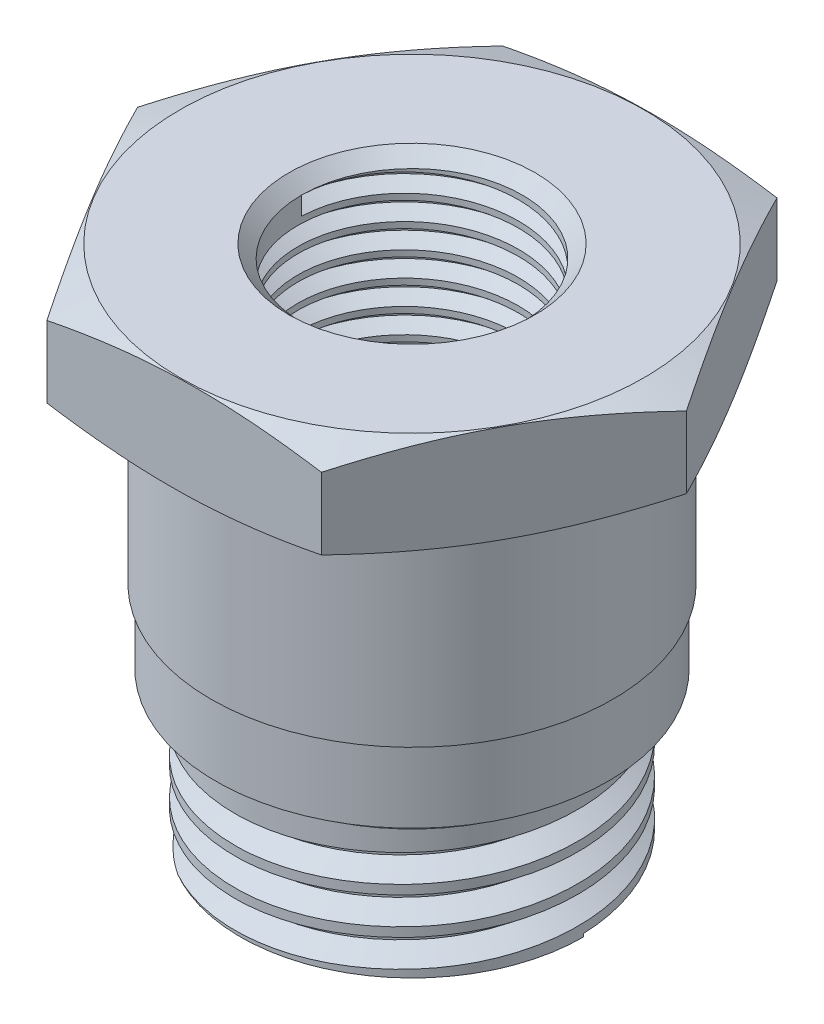
from build123d import *

# Parameters (mm, degrees)
RESSALTO_EXTRUS_O1_DEPTH             = 4
ESBO_O4_OUTSIDE_W                    = 101.256
ESBO_O4_OUTSIDE_H                    = 98.55
ESBO_O4_OUTSIDE_R                    = 9.5
CORTE_EXTRUS_O2_DEPTH                = 13
CORTE_EXTRUS_O2_DRAFT                = -70
ESBO_O5_OUTSIDE_W                    = 101.256
ESBO_O5_OUTSIDE_H                    = 98.55
ESBO_O5_OUTSIDE_R                    = 9.472261518
CORTE_EXTRUS_O3_DEPTH                = 13
CORTE_EXTRUS_O3_DRAFT                = -70
ESBO_O6_R                            = 8.2
RESSALTO_EXTRUS_O2_DEPTH             = 8
ESBO_O7_R                            = 8
RESSALTO_EXTRUS_O3_DEPTH             = 3
ESBO_O8_R                            = 7
RESSALTO_EXTRUS_O4_DEPTH             = 6
ESBO_O9_R                            = 5.2
CORTE_EXTRUS_O4_DEPTH                = 14
FURO_ROSCADO_DE_M10X1_01_D           = 9
FURO_ROSCADO_DE_M10X1_01_CSINK_D     = 10.05
FURO_ROSCADO_DE_M10X1_01_CSINK_ANGLE = 90
ROSCA1_PITCH                         = 1
MOVER_START                          = -19
MOVER_FACE1_OUTLINE_R                = 7
MOVER_FACE1_OUTLINE_R_2              = 5.2
MOVER_FACE1_DEPTH                    = 2
ESBO_O15_R                           = 9.5
CORTE_EXTRUS_O6_DEPTH                = 2
ESBO_O19_W                           = 1.509856989
ESBO_O19_H                           = 0.736006145
ROSCA2_PITCH                         = 1.5


# Read off the part's stored shape, not the designer's step: Mover face1
with BuildPart() as part:
    # Esboço1 → Ressalto-extrusão1 (new body)
    with BuildSketch(Plane(origin=(0, 0, 0), x_dir=(1, 0, 0), z_dir=(0, 1, 0))):
        Polygon((5.283091157, 9.613650772), (-5.684120213, 9.382116538), (-10.96721137, -0.231534234), (-5.283091157, -9.613650772), (5.684120213, -9.382116538), (10.96721137, 0.231534234), align=None)
    extrude(amount=RESSALTO_EXTRUS_O1_DEPTH)


with BuildPart() as corte_extrus_o2_tool:
    # Esboço4 outside → Corte-extrusão2 (with draft: the straight prism first)
    with BuildSketch(Plane.XZ):
        Rectangle(ESBO_O4_OUTSIDE_W, ESBO_O4_OUTSIDE_H)
        Circle(ESBO_O4_OUTSIDE_R, mode=Mode.SUBTRACT)
    extrude(amount=-CORTE_EXTRUS_O2_DEPTH)
    # Corte-extrusão2: the draft: its side faces are tilted about the plane it starts from
    corte_extrus_o2_sides = [corte_extrus_o2_tool.faces().sort_by_distance(p)[0] for p in [
        (0, 6.5, -49.275),
        (50.628, 6.5, 0),
        (0, 6.5, 49.275),
        (-50.628, 6.5, 0),
        (-9.5, 6.5, 0),
    ]]
    draft(corte_extrus_o2_sides, Plane.XZ, CORTE_EXTRUS_O2_DRAFT)


with BuildPart() as part_1:
    add(part.part)

    # Corte-extrusão2: cut by corte_extrus_o2_tool
    add(corte_extrus_o2_tool.part, mode=Mode.SUBTRACT)


with BuildPart() as corte_extrus_o3_tool:
    # Esboço5 outside → Corte-extrusão3 (with draft: the straight prism first)
    with BuildSketch(Plane(origin=(0, 4, 0), x_dir=(1, 0, 0), z_dir=(0, 1, 0))):
        Rectangle(ESBO_O5_OUTSIDE_W, ESBO_O5_OUTSIDE_H)
        Circle(ESBO_O5_OUTSIDE_R, mode=Mode.SUBTRACT)
    extrude(amount=-CORTE_EXTRUS_O3_DEPTH)
    # Corte-extrusão3: the draft: its side faces are tilted about the plane it starts from
    corte_extrus_o3_sides = [corte_extrus_o3_tool.faces().sort_by_distance(p)[0] for p in [
        (0, -2.5, 49.275),
        (50.628, -2.5, 0),
        (0, -2.5, -49.275),
        (-50.628, -2.5, 0),
        (-9.472261518, -2.5, 0),
    ]]
    draft(corte_extrus_o3_sides, Plane(origin=(0, 4, 0), x_dir=(1, 0, 0), z_dir=(0, 1, 0)), CORTE_EXTRUS_O3_DRAFT)


with BuildPart() as part_2:
    add(part_1.part)

    # Corte-extrusão3: cut by corte_extrus_o3_tool
    add(corte_extrus_o3_tool.part, mode=Mode.SUBTRACT)

    # Esboço6 → Ressalto-extrusão2 (add)
    with BuildSketch(Plane.XZ):
        with Locations(Location((0, 0, 0), (0, 0, 90))):
            Circle(ESBO_O6_R)
    extrude(amount=RESSALTO_EXTRUS_O2_DEPTH)

    # Esboço7 → Ressalto-extrusão3 (add)
    with BuildSketch(Plane.XZ.offset(8)):
        with Locations(Location((0, 0, 0), (0, 0, 270))):
            Circle(ESBO_O7_R)
    extrude(amount=RESSALTO_EXTRUS_O3_DEPTH)

    # Esboço8 → Ressalto-extrusão4 (add)
    with BuildSketch(Plane.XZ.offset(11)):
        with Locations(Location((0, 0, 0), (0, 0, 270))):
            Circle(ESBO_O8_R)
    extrude(amount=RESSALTO_EXTRUS_O4_DEPTH)

    # Esboço9 → Corte-extrusão4 (cut)
    with BuildSketch(Plane.XZ.offset(17)):
        with Locations(Location((0, 0, 0), (0, 0, 270))):
            Circle(ESBO_O9_R)
    extrude(amount=-CORTE_EXTRUS_O4_DEPTH, mode=Mode.SUBTRACT)

    # Furo roscado de M10x1.01 (through all)
    with Locations(Plane(origin=(0, 4, 0), x_dir=(1, 0, 0), z_dir=(0, 1, 0))):
        with Locations((0, 0)):
            CounterSinkHole(FURO_ROSCADO_DE_M10X1_01_D / 2, FURO_ROSCADO_DE_M10X1_01_CSINK_D / 2, counter_sink_angle=FURO_ROSCADO_DE_M10X1_01_CSINK_ANGLE)

    # Rosca1: the profile of Perfil da rosca1 profile screwed along a right-hand helix of 10 turns, 8 arcs to a turn; built about Z, then put on its axis
    rosca1_z = Axis((0, 0, 0), (0, 0, 1))
    rosca1_corners = [(4.4997, 0, -0.000173205), (5.041265875, 0, 0.312499999), (5.041265875, 0, 0.437499999), (4.4997, 0, 0.750173202)]
    with BuildLine(mode=Mode.PRIVATE) as rosca1_profile:
        Line(rosca1_corners[0], rosca1_corners[1])
        Line(rosca1_corners[1], rosca1_corners[2])
        Line(rosca1_corners[2], rosca1_corners[3])
        Line(rosca1_corners[3], rosca1_corners[0])
    rosca1_cap = Face(rosca1_profile.wire())
    rosca1_turn_angles = [0, 22.5, 45, 67.5, 90, 112.5, 135, 157.5, 180, 202.5, 225, 247.5, 270, 292.5, 315, 337.5, 360]
    rosca1_turn_weights = [1, 0.9238795325112867, 1, 0.9238795325112867, 1, 0.9238795325112867, 1, 0.9238795325112867, 1, 0.9238795325112867, 1, 0.9238795325112867, 1, 0.9238795325112867, 1, 0.9238795325112867, 1]
    rosca1_turn_rails = [Edge.make_bspline([Vector(p[0], p[1], 0).rotate(rosca1_z, rosca1_turn_angles[k]) / rosca1_turn_weights[k] + Vector(0, 0, p[2] + ROSCA1_PITCH * rosca1_turn_angles[k] / 360) for k in range(17)], [0, 0, 0, 1, 1, 2, 2, 3, 3, 4, 4, 5, 5, 6, 6, 7, 7, 8, 8, 8], 2, rosca1_turn_weights) for p in rosca1_corners]
    rosca1_turn_sides = [Face.make_surface_from_curves(rosca1_turn_rails[p[0]], rosca1_turn_rails[p[1]]) for p in [(0, 1), (1, 2), (2, 3), (3, 0)]]
    rosca1 = Plane(origin=(0, 3.475, 0), x_dir=(-1, 0, 0), z_dir=(0, -1, 0)) * Solid(Shell([*[p.moved(Location((0, 0, ROSCA1_PITCH * i))) for i in range(10) for p in rosca1_turn_sides], rosca1_cap, rosca1_cap.rotate(rosca1_z, 3600).moved(Location((0, 0, ROSCA1_PITCH * 3600 / 360)))]))
    add(rosca1, mode=Mode.SUBTRACT)

    # Mover face1 outline → Mover face1 (add)
    with BuildSketch(Plane(origin=(0, 0, 0), x_dir=(1, 0, 0), z_dir=(0, 1, 0)).offset(MOVER_START)):
        Circle(MOVER_FACE1_OUTLINE_R)
        Circle(MOVER_FACE1_OUTLINE_R_2, mode=Mode.SUBTRACT)
    extrude(amount=MOVER_FACE1_DEPTH)

    # Esboço15 → Corte-extrusão6 (cut)
    with BuildSketch(Plane.XZ.offset(19)):
        Circle(ESBO_O15_R)
    extrude(amount=-CORTE_EXTRUS_O6_DEPTH, mode=Mode.SUBTRACT)

    # Esboço19 → Corte-Revolução1 (revolve, cut)
    with BuildSketch(Plane(origin=(0, 0, 0), x_dir=(0, 0, -1), z_dir=(1, 0, 0))):
        with Locations((-7.109843321, -11.368003073)):
            Rectangle(ESBO_O19_W, ESBO_O19_H)
    revolve(axis=Axis((0, 0, 0), (0, -1, 0)), mode=Mode.SUBTRACT)

    # Rosca2: the profile of Perfil da rosca2 profile screwed along a right-hand helix of 3.5 turns, 8 arcs to a turn; built about Z, then put on its axis
    rosca2_z = Axis((0, 0, 0), (0, 0, 1))
    rosca2_corners = [(7.0003, 0, -0.000173205), (6.188101188, 0, 0.468749998), (6.188101188, 0, 0.656249998), (7.0003, 0, 1.125173201)]
    with BuildLine(mode=Mode.PRIVATE) as rosca2_profile:
        Line(rosca2_corners[0], rosca2_corners[1])
        Line(rosca2_corners[1], rosca2_corners[2])
        Line(rosca2_corners[2], rosca2_corners[3])
        Line(rosca2_corners[3], rosca2_corners[0])
    rosca2_cap = Face(rosca2_profile.wire())
    rosca2_turn_angles = [0, 22.5, 45, 67.5, 90, 112.5, 135, 157.5, 180, 202.5, 225, 247.5, 270, 292.5, 315, 337.5, 360]
    rosca2_turn_weights = [1, 0.9238795325112867, 1, 0.9238795325112867, 1, 0.9238795325112867, 1, 0.9238795325112867, 1, 0.9238795325112867, 1, 0.9238795325112867, 1, 0.9238795325112867, 1, 0.9238795325112867, 1]
    rosca2_turn_rails = [Edge.make_bspline([Vector(p[0], p[1], 0).rotate(rosca2_z, rosca2_turn_angles[k]) / rosca2_turn_weights[k] + Vector(0, 0, p[2] + ROSCA2_PITCH * rosca2_turn_angles[k] / 360) for k in range(17)], [0, 0, 0, 1, 1, 2, 2, 3, 3, 4, 4, 5, 5, 6, 6, 7, 7, 8, 8, 8], 2, rosca2_turn_weights) for p in rosca2_corners]
    rosca2_turn_sides = [Face.make_surface_from_curves(rosca2_turn_rails[p[0]], rosca2_turn_rails[p[1]]) for p in [(0, 1), (1, 2), (2, 3), (3, 0)]]
    rosca2_last_angles = [1080, 1102.5, 1125, 1147.5, 1170, 1192.5, 1215, 1237.5, 1260]
    rosca2_last_weights = [1, 0.9238795325112867, 1, 0.9238795325112867, 1, 0.9238795325112867, 1, 0.9238795325112867, 1]
    rosca2_last_rails = [Edge.make_bspline([Vector(p[0], p[1], 0).rotate(rosca2_z, rosca2_last_angles[k]) / rosca2_last_weights[k] + Vector(0, 0, p[2] + ROSCA2_PITCH * rosca2_last_angles[k] / 360) for k in range(9)], [0, 0, 0, 1, 1, 2, 2, 3, 3, 4, 4, 4], 2, rosca2_last_weights) for p in rosca2_corners]
    rosca2_last_sides = [Face.make_surface_from_curves(rosca2_last_rails[p[0]], rosca2_last_rails[p[1]]) for p in [(0, 1), (1, 2), (2, 3), (3, 0)]]
    rosca2 = Plane(origin=(0, -18, 0), x_dir=(1, 0, 0), z_dir=(0, 1, 0)) * Solid(Shell([*[p.moved(Location((0, 0, ROSCA2_PITCH * i))) for i in range(3) for p in rosca2_turn_sides], *rosca2_last_sides, rosca2_cap, rosca2_cap.rotate(rosca2_z, 1260).moved(Location((0, 0, ROSCA2_PITCH * 1260 / 360)))]))
    add(rosca2, mode=Mode.SUBTRACT)


solid = part_2.part
